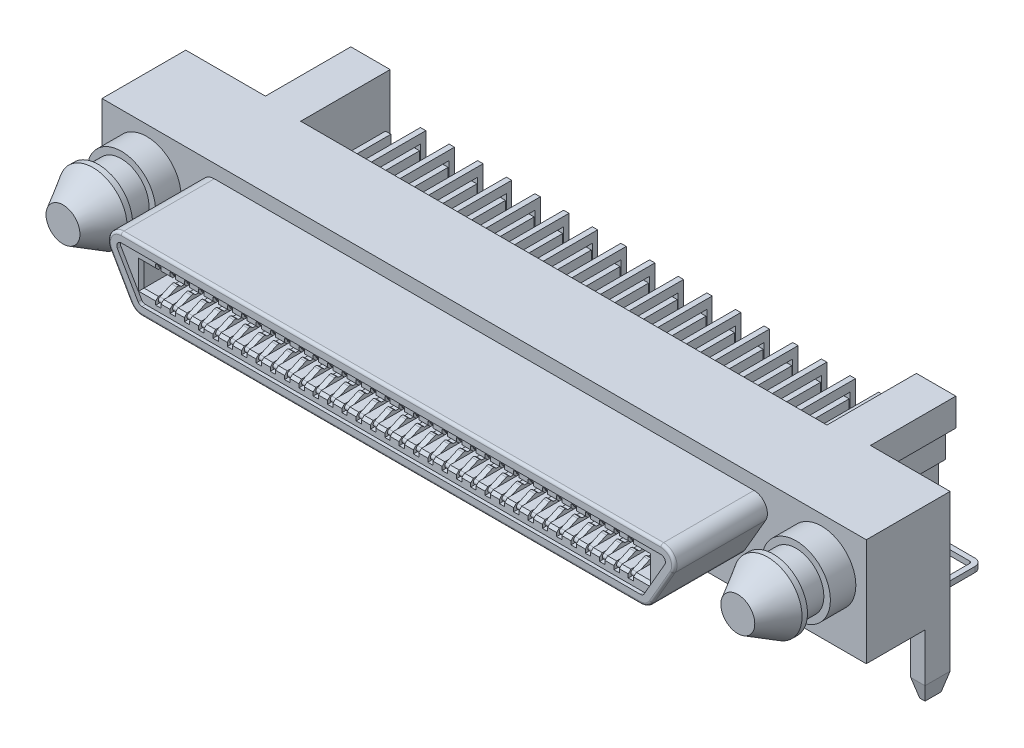
from build123d import *
from OCP.BRepFilletAPI import BRepFilletAPI_MakeChamfer

# Parameters (mm, degrees)
BODY_1_DEPTH                = 6
SKETCH68_W                  = 29.4
SKETCH68_H                  = 5
BODY_1_CUT_1_DEPTH          = 114.3
SKETCH76_W                  = 42.7
SKETCH76_H                  = 6
BODY_3_DEPTH                = 0.35
WT_SLOT_DEPTH               = 4.77
WT_1_DEPTH                  = 0.15
WT_2_DEPTH                  = 0.3
BODY_2_DEPTH                = 5.2
BODY_2_FIL_R                = 0.15
SKETCH62_W                  = 28.3
SKETCH62_H                  = 1.3
CORE_1_DEPTH                = 5
CORE_LEAD_IN_SIZE           = 0.15
SKETCH70_W                  = 0.8
SKETCH70_H                  = 1.4
GUIDE_POST_2_DEPTH          = 3.7
GUIDE_POST_2_POINT_SIZE     = 1
GUIDE_POST_2_POINT_SIZE2    = 0.25
SKETCH63_W                  = 5
SKETCH63_H                  = 0.5
SLOT_DEPTH                  = 0.15
SLOT_PAT_COUNT              = 34
SLOT_PAT_PITCH              = 0.8
CONTACT_1_DEPTH             = 0.15
CONTACT_2_DEPTH             = 0.15
CONTACT_1_PAT_COUNT         = 17
CONTACT_1_PAT_PITCH         = 1.6
CONTACT_2_PAT_COUNT         = 17
CONTACT_2_PAT_PITCH         = 1.6
SKETCH77_W                  = 0.3
SKETCH77_H                  = 0.3
CONTACT1_TAIL_DEPTH         = 3.99
SKETCH78_W                  = 0.3
SKETCH78_H                  = 0.3
CONTACT3_TAIL_DEPTH         = 3.99
CONTACT1_TAIL_PATTERN_COUNT = 17
CONTACT1_TAIL_PATTERN_PITCH = 1.6
CONTACT3_TAIL_PATTERN_COUNT = 17
CONTACT3_TAIL_PATTERN_PITCH = 1.6


with BuildPart() as part:
    # Sketch1 → Body 1 (new body)
    with BuildSketch(Plane(origin=(0, 0, 0), x_dir=(1, 0, 0), z_dir=(0, 1, 0))):
        Polygon((16.9, 9.1), (16.9, 4.33), (21.35, 4.33), (21.35, 0), (-21.35, 0), (-21.35, 4.33), (-16.9, 4.33), (-16.9, 9.1), align=None)
    extrude(amount=BODY_1_DEPTH)

    # Sketch68 → Body 1 Cut 1 (cut)
    with BuildSketch(Plane(origin=(0, 6, 0), x_dir=(1, 0, 0), z_dir=(0, 1, 0))):
        with Locations((0, 6.6)):
            Rectangle(SKETCH68_W, SKETCH68_H)
    extrude(amount=-BODY_1_CUT_1_DEPTH, mode=Mode.SUBTRACT)

    # Sketch76 → Body 3 (add)
    with BuildSketch(Plane.XY):
        with Locations((0, 3)):
            Rectangle(SKETCH76_W, SKETCH76_H)
    extrude(amount=BODY_3_DEPTH)

    # Sketch75 → Guide Post 1 (revolve)
    with BuildSketch(Plane(origin=(-18.85, 0, 0), x_dir=(0, 0, -1), z_dir=(1, 0, 0)), mode=Mode.PRIVATE) as guide_post_1_sk:
        Polygon((-0.35, 5.4125), (-1.772, 5.4125), (-1.772, 5.0475), (-3.052, 5.0475), (-3.052, 5.4125), (-3.356, 5.4125), (-5.03, 4.446015649), (-5.03, 3.4975), (-0.35, 3.4975), align=None)
    guide_post_1 = revolve(guide_post_1_sk.sketch.rotate(Axis((-18.85, 3.4975, -2.165), (0, 0, 1)), 90), axis=Axis((-18.85, 3.4975, -2.165), (0, 0, 1)))

    # Guide Post 1 Mir: Guide Post 1 across plane
    add(guide_post_1.mirror(Plane(origin=(0, 0, 0), x_dir=(0, 0, 1), z_dir=(1, 0, 0))))

    # Sketch65 → WT Slot (cut)
    with BuildSketch(Plane(origin=(0, 0, -9.1), x_dir=(-1, 0, 0), z_dir=(0, 0, -1))):
        Polygon((15.925, 4.450000052), (16.025, 4.450000052), (16.025, 4.847367304), (16.325, 4.847367304), (16.325, 4.450000052), (16.9, 4.450000052), (16.9, 0), (15.925, 0), align=None)
    wt_slot = extrude(amount=-WT_SLOT_DEPTH, mode=Mode.SUBTRACT)

    # Sketch66 → WT 1 (add, symmetric)
    with BuildSketch(Plane(origin=(-16.175, 0, 0), x_dir=(0, 0, -1), z_dir=(1, 0, 0))):
        with BuildLine():
            Line((9.1, 4.747367383), (4.33, 4.747367383))
            Line((4.33, 4.747367383), (4.33, 2.64736737))
            Line((4.33, 2.64736737), (5, 2.64736737))
            Line((5, 2.64736737), (5, 0.300000002))
            Line((5, 0.300000002), (5.291596718, 0.300000002))
            Line((5.291596718, 0.300000002), (5.291596718, 1.473683686))
            ThreePointArc((5.291596718, 1.473683686), (5.491596719, 1.673683687), (5.69159672, 1.473683686))
            Line((5.69159672, 1.473683686), (5.69159672, -1.58713511))
            ThreePointArc((5.69159672, -1.58713511), (5.686451936, -1.626083363), (5.671370502, -1.662359878))
            Line((5.671370502, -1.662359878), (5.589499751, -1.803598957))
            ThreePointArc((5.589499751, -1.803598957), (5.569468823, -1.871171992), (5.582510469, -1.94043431))
            Line((5.582510469, -1.94043431), (5.763236932, -2.341610585))
            ThreePointArc((5.763236932, -2.341610585), (5.931508253, -2.426653434), (6.049999999, -2.279999999))
            Line((6.049999999, -2.279999999), (6.049999999, 1.473683686))
            ThreePointArc((6.049999999, 1.473683686), (6.25, 1.673683687), (6.450000001, 1.473683686))
            Line((6.450000001, 1.473683686), (6.450000001, -2.279999999))
            ThreePointArc((6.450000001, -2.279999999), (6.568491747, -2.426653434), (6.736763068, -2.341610585))
            Line((6.736763068, -2.341610585), (6.917489531, -1.94043431))
            ThreePointArc((6.917489531, -1.94043431), (6.930531177, -1.871171992), (6.910500249, -1.803598957))
            Line((6.910500249, -1.803598957), (6.828629498, -1.662359878))
            ThreePointArc((6.828629498, -1.662359878), (6.813548064, -1.626083363), (6.80840328, -1.58713511))
            Line((6.80840328, -1.58713511), (6.80840328, 1.473683686))
            ThreePointArc((6.80840328, 1.473683686), (7.008403281, 1.673683687), (7.208403282, 1.473683686))
            Line((7.208403282, 1.473683686), (7.208403282, 0.300000002))
            Line((7.208403282, 0.300000002), (7.500000017, 0.300000002))
            Line((7.500000017, 0.300000002), (7.500000017, 2.64736737))
            Line((7.500000017, 2.64736737), (9.1, 2.64736737))
            Line((9.1, 2.64736737), (9.1, 4.747367383))
        make_face()
    wt_1 = extrude(amount=WT_1_DEPTH, both=True)

    # Sketch67 → WT 2 (add)
    with BuildSketch(Plane(origin=(0, 0, 0), x_dir=(1, 0, 0), z_dir=(0, 1, 0))):
        with BuildLine():
            Line((-19.5749, 7.500000017), (-16.025, 7.500000017))
            Line((-16.025, 7.500000017), (-16.025, 7.208403299))
            Line((-16.025, 7.208403299), (-19.5749, 7.208403299))
            ThreePointArc((-19.5749, 7.208403299), (-19.651552696, 7.176652713), (-19.683303282, 7.100000017))
            Line((-19.683303282, 7.100000017), (-19.683303282, 5.4))
            ThreePointArc((-19.683303282, 5.4), (-19.651552696, 5.323347304), (-19.5749, 5.291596718))
            Line((-19.5749, 5.291596718), (-16.025, 5.291596718))
            Line((-16.025, 5.291596718), (-16.025, 5))
            Line((-16.025, 5), (-19.5749, 5))
            ThreePointArc((-19.5749, 5), (-19.857742712, 5.117157288), (-19.9749, 5.4))
            Line((-19.9749, 5.4), (-19.9749, 7.100000017))
            ThreePointArc((-19.9749, 7.100000017), (-19.857742712, 7.382842729), (-19.5749, 7.500000017))
        make_face()
    wt_2 = extrude(amount=WT_2_DEPTH)

    # WT Slot Mir: WT Slot, WT 1, WT 2 across plane
    add(wt_slot.mirror(Plane(origin=(0, 0, 0), x_dir=(0, 0, 1), z_dir=(1, 0, 0))), mode=Mode.SUBTRACT)
    add(wt_1.mirror(Plane(origin=(0, 0, 0), x_dir=(0, 0, 1), z_dir=(1, 0, 0))))
    add(wt_2.mirror(Plane(origin=(0, 0, 0), x_dir=(0, 0, 1), z_dir=(1, 0, 0))))

    # Sketch61 → Body 2 (add)
    with BuildSketch(Plane.XY.offset(0.35)):
        with BuildLine():
            Line((-15.075, 5.25), (15.075, 5.25))
            ThreePointArc((15.075, 5.25), (15.724519053, 4.875), (15.724519053, 4.125))
            Line((15.724519053, 4.125), (14.569818514, 2.125))
            ThreePointArc((14.569818514, 2.125), (14.295299462, 1.850480947), (13.920299462, 1.75))
            Line((13.920299462, 1.75), (-13.920299462, 1.75))
            ThreePointArc((-13.920299462, 1.75), (-14.295299462, 1.850480947), (-14.569818514, 2.125))
            Line((-14.569818514, 2.125), (-15.724519053, 4.125))
            ThreePointArc((-15.724519053, 4.125), (-15.724519053, 4.875), (-15.075, 5.25))
        make_face()
        with BuildLine():
            Line((-15.075, 4.75), (15.075, 4.75))
            ThreePointArc((15.075, 4.75), (15.291506351, 4.625), (15.291506351, 4.375))
            Line((15.291506351, 4.375), (14.136805813, 2.375))
            ThreePointArc((14.136805813, 2.375), (14.045299462, 2.283493649), (13.920299462, 2.25))
            Line((13.920299462, 2.25), (-13.920299462, 2.25))
            ThreePointArc((-13.920299462, 2.25), (-14.045299462, 2.283493649), (-14.136805813, 2.375))
            Line((-14.136805813, 2.375), (-15.291506351, 4.375))
            ThreePointArc((-15.291506351, 4.375), (-15.291506351, 4.625), (-15.075, 4.75))
        make_face(mode=Mode.SUBTRACT)
    extrude(amount=BODY_2_DEPTH)

    # Body 2 Fil
    body_2_fil_edges = [part.edges().sort_by_distance(p)[0] for p in [
        (14.295299462, 1.850480947, 5.55),
        (15.147168784, 3.125, 5.55),
        (15.724519053, 4.875, 5.55),
        (0, 5.25, 5.55),
        (-15.724519053, 4.875, 5.55),
        (-15.147168784, 3.125, 5.55),
        (-14.295299462, 1.850480947, 5.55),
        (0, 1.75, 5.55),
    ]]
    fillet(body_2_fil_edges, radius=BODY_2_FIL_R)

    # Sketch62 → Core 1 (add)
    with BuildSketch(Plane.XY.offset(0.35)):
        with BuildLine():
            Line((15.075, 4.75), (-15.075, 4.75))
            ThreePointArc((-15.075, 4.75), (-15.291506351, 4.625), (-15.291506351, 4.375))
            Line((-15.291506351, 4.375), (-14.136805813, 2.375))
            ThreePointArc((-14.136805813, 2.375), (-14.045299462, 2.283493649), (-13.920299462, 2.25))
            Line((-13.920299462, 2.25), (13.920299462, 2.25))
            ThreePointArc((13.920299462, 2.25), (14.045299462, 2.283493649), (14.136805813, 2.375))
            Line((14.136805813, 2.375), (15.291506351, 4.375))
            ThreePointArc((15.291506351, 4.375), (15.291506351, 4.625), (15.075, 4.75))
        make_face()
        with Locations((0, 3.5)):
            Rectangle(SKETCH62_W, SKETCH62_H, mode=Mode.SUBTRACT)
    extrude(amount=CORE_1_DEPTH)

    # Core Lead-in
    core_lead_in_edges = [part.edges().sort_by_distance(p)[0] for p in [
        (-14.15, 3.5, 5.35),
        (0, 2.85, 5.35),
        (14.15, 3.5, 5.35),
        (0, 4.15, 5.35),
    ]]
    chamfer(core_lead_in_edges, length=CORE_LEAD_IN_SIZE)

    # Sketch70 → Guide Post 2 (add)
    with BuildSketch(Plane.XZ):
        with Locations((20.95, -3.63)):
            Rectangle(SKETCH70_W, SKETCH70_H)
        with Locations((-20.95, -3.63)):
            Rectangle(SKETCH70_W, SKETCH70_H)
    extrude(amount=GUIDE_POST_2_DEPTH)

    # Guide Post 2  Point: one chamfer whose edges measure the first distance from different faces: ONE call of the kernel's chamfer builder (chamfer() names one face for all edges)
    guide_post_2_point_edges_1 = [part.edges().sort_by_distance(p)[0] for p in [
        (20.95, -3.7, -4.33),
    ]]
    guide_post_2_point_side_1 = [part.faces().sort_by_distance(p)[0] for p in [
        (18.982387314, 2.461555528, -4.33),
    ]]
    guide_post_2_point_edges_2 = [part.edges().sort_by_distance(p)[0] for p in [
        (21.35, -3.7, -3.63),
    ]]
    guide_post_2_point_side_2 = [part.faces().sort_by_distance(p)[0] for p in [
        (21.35, 2.244648226, -2.245417919),
    ]]
    guide_post_2_point_edges_3 = [part.edges().sort_by_distance(p)[0] for p in [
        (20.95, -3.7, -2.93),
    ]]
    guide_post_2_point_side_3 = [part.faces().sort_by_distance(p)[0] for p in [
        (20.95, -1.85, -2.93),
    ]]
    guide_post_2_point_edges_4 = [part.edges().sort_by_distance(p)[0] for p in [
        (20.55, -3.7, -3.63),
    ]]
    guide_post_2_point_side_4 = [part.faces().sort_by_distance(p)[0] for p in [
        (20.55, -1.85, -3.63),
    ]]
    guide_post_2_point_edges_5 = [part.edges().sort_by_distance(p)[0] for p in [
        (-20.55, -3.7, -3.63),
    ]]
    guide_post_2_point_side_5 = [part.faces().sort_by_distance(p)[0] for p in [
        (-20.55, -1.85, -3.63),
    ]]
    guide_post_2_point_edges_6 = [part.edges().sort_by_distance(p)[0] for p in [
        (-20.95, -3.7, -4.33),
    ]]
    guide_post_2_point_side_6 = [part.faces().sort_by_distance(p)[0] for p in [
        (-18.982387314, 2.461555528, -4.33),
    ]]
    guide_post_2_point_edges_7 = [part.edges().sort_by_distance(p)[0] for p in [
        (-21.35, -3.7, -3.63),
    ]]
    guide_post_2_point_side_7 = [part.faces().sort_by_distance(p)[0] for p in [
        (-21.35, 2.244648226, -2.245417919),
    ]]
    guide_post_2_point_edges_8 = [part.edges().sort_by_distance(p)[0] for p in [
        (-20.95, -3.7, -2.93),
    ]]
    guide_post_2_point_side_8 = [part.faces().sort_by_distance(p)[0] for p in [
        (-20.95, -1.85, -2.93),
    ]]
    guide_post_2_point = BRepFilletAPI_MakeChamfer(part.part.solid().wrapped)
    for e in guide_post_2_point_edges_1:
        guide_post_2_point.Add(GUIDE_POST_2_POINT_SIZE, GUIDE_POST_2_POINT_SIZE2, e.wrapped, guide_post_2_point_side_1[0].wrapped)  # the first distance lies on this face
    for e in guide_post_2_point_edges_2:
        guide_post_2_point.Add(GUIDE_POST_2_POINT_SIZE, GUIDE_POST_2_POINT_SIZE2, e.wrapped, guide_post_2_point_side_2[0].wrapped)  # the first distance lies on this face
    for e in guide_post_2_point_edges_3:
        guide_post_2_point.Add(GUIDE_POST_2_POINT_SIZE, GUIDE_POST_2_POINT_SIZE2, e.wrapped, guide_post_2_point_side_3[0].wrapped)  # the first distance lies on this face
    for e in guide_post_2_point_edges_4:
        guide_post_2_point.Add(GUIDE_POST_2_POINT_SIZE, GUIDE_POST_2_POINT_SIZE2, e.wrapped, guide_post_2_point_side_4[0].wrapped)  # the first distance lies on this face
    for e in guide_post_2_point_edges_5:
        guide_post_2_point.Add(GUIDE_POST_2_POINT_SIZE, GUIDE_POST_2_POINT_SIZE2, e.wrapped, guide_post_2_point_side_5[0].wrapped)  # the first distance lies on this face
    for e in guide_post_2_point_edges_6:
        guide_post_2_point.Add(GUIDE_POST_2_POINT_SIZE, GUIDE_POST_2_POINT_SIZE2, e.wrapped, guide_post_2_point_side_6[0].wrapped)  # the first distance lies on this face
    for e in guide_post_2_point_edges_7:
        guide_post_2_point.Add(GUIDE_POST_2_POINT_SIZE, GUIDE_POST_2_POINT_SIZE2, e.wrapped, guide_post_2_point_side_7[0].wrapped)  # the first distance lies on this face
    for e in guide_post_2_point_edges_8:
        guide_post_2_point.Add(GUIDE_POST_2_POINT_SIZE, GUIDE_POST_2_POINT_SIZE2, e.wrapped, guide_post_2_point_side_8[0].wrapped)  # the first distance lies on this face
    add(Compound.cast(guide_post_2_point.Shape()), mode=Mode.REPLACE)

    # Sketch63 → Slot (cut, symmetric)
    with BuildSketch(Plane(origin=(13.2, 0, 0), x_dir=(0, 0, -1), z_dir=(1, 0, 0))):
        with Locations((-2.85, 4.25)):
            Rectangle(SKETCH63_W, SKETCH63_H)
        with Locations((-2.85, 2.75)):
            Rectangle(SKETCH63_W, SKETCH63_H)
    slot = extrude(amount=SLOT_DEPTH, both=True, mode=Mode.SUBTRACT)

    # Slot Pat: Slot ×34
    with Locations(*[(-i * SLOT_PAT_PITCH, 0, 0) for i in range(1, SLOT_PAT_COUNT)]):
        add(slot, mode=Mode.SUBTRACT)

    # Sketch69 → Contact 1 (add, symmetric)
    with BuildSketch(Plane(origin=(13.2, 0, 0), x_dir=(0, 0, -1), z_dir=(1, 0, 0))):
        with BuildLine():
            Line((-5.05, 4.5), (8.64, 4.5))
            Line((8.64, 4.5), (8.64, 1.7))
            Line((8.64, 1.7), (8.34, 1.7))
            Line((8.34, 1.7), (8.34, 4))
            Line((8.34, 4), (-4.230918697, 4))
            Line((-4.230918697, 4), (-4.304525443, 3.938015372))
            ThreePointArc((-4.304525443, 3.938015372), (-4.380933964, 3.904120018), (-4.463619076, 3.916380902))
            Line((-4.463619076, 3.916380902), (-5.112473272, 4.213628851))
            ThreePointArc((-5.112473272, 4.213628851), (-5.196553186, 4.381971297), (-5.05, 4.5))
        make_face()
        with BuildLine():
            Line((-5.05, 2.5), (5.99, 2.5))
            Line((5.99, 2.5), (5.99, 1.7))
            Line((5.99, 1.7), (6.29, 1.7))
            Line((6.29, 1.7), (6.29, 3))
            Line((6.29, 3), (-4.230918697, 3))
            Line((-4.230918697, 3), (-4.304525443, 3.061984628))
            ThreePointArc((-4.304525443, 3.061984628), (-4.380933964, 3.095879982), (-4.463619076, 3.083619098))
            Line((-4.463619076, 3.083619098), (-5.112473272, 2.786371149))
            ThreePointArc((-5.112473272, 2.786371149), (-5.196553186, 2.618028703), (-5.05, 2.5))
        make_face()
    contact_1 = extrude(amount=CONTACT_1_DEPTH, both=True)

    # Sketch73 → Contact 2 (add, symmetric)
    with BuildSketch(Plane(origin=(12.4, 0, 0), x_dir=(0, 0, -1), z_dir=(1, 0, 0))):
        with BuildLine():
            Line((4.84, 1.7), (4.84, 2.5))
            Line((4.84, 2.5), (-5.05, 2.5))
            ThreePointArc((-5.05, 2.5), (-5.196553186, 2.618028703), (-5.112473272, 2.786371149))
            Line((-5.112473272, 2.786371149), (-4.463619076, 3.083619098))
            ThreePointArc((-4.463619076, 3.083619098), (-4.380933964, 3.095879982), (-4.304525443, 3.061984628))
            Line((-4.304525443, 3.061984628), (-4.230918697, 3))
            Line((-4.230918697, 3), (5.14, 3))
            Line((5.14, 3), (5.14, 1.7))
            Line((5.14, 1.7), (4.84, 1.7))
        make_face()
        with BuildLine():
            Line((7.49, 1.7), (7.49, 4.5))
            Line((7.49, 4.5), (-5.05, 4.5))
            ThreePointArc((-5.05, 4.5), (-5.196553186, 4.381971297), (-5.112473272, 4.213628851))
            Line((-5.112473272, 4.213628851), (-4.463619076, 3.916380902))
            ThreePointArc((-4.463619076, 3.916380902), (-4.380933964, 3.904120018), (-4.304525443, 3.938015372))
            Line((-4.304525443, 3.938015372), (-4.230918697, 4))
            Line((-4.230918697, 4), (7.19, 4))
            Line((7.19, 4), (7.19, 1.7))
            Line((7.19, 1.7), (7.49, 1.7))
        make_face()
    contact_2 = extrude(amount=CONTACT_2_DEPTH, both=True)

    # Contact 1 Pat: Contact 1 ×17
    with Locations(*[(-i * CONTACT_1_PAT_PITCH, 0, 0) for i in range(1, CONTACT_1_PAT_COUNT)]):
        add(contact_1)

    # Contact 2 Pat: Contact 2 ×17
    with Locations(*[(-i * CONTACT_2_PAT_PITCH, 0, 0) for i in range(1, CONTACT_2_PAT_COUNT)]):
        add(contact_2)

    # Sketch77 → Contact1 Tail (add)
    with BuildSketch(Plane.XZ.offset(-1.7)):
        with Locations((13, -8.49)):
            Rectangle(SKETCH77_W, SKETCH77_H)
        with Locations((13.4, -6.14)):
            Rectangle(SKETCH77_W, SKETCH77_H)
    contact1_tail = extrude(amount=CONTACT1_TAIL_DEPTH)

    # Sketch78 → Contact3 Tail (add)
    with BuildSketch(Plane.XZ.offset(-1.7)):
        with Locations((12.6, -4.99)):
            Rectangle(SKETCH78_W, SKETCH78_H)
        with Locations((12.2, -7.34)):
            Rectangle(SKETCH78_W, SKETCH78_H)
    contact3_tail = extrude(amount=CONTACT3_TAIL_DEPTH)

    # Contact1 Tail Pattern: Contact1 Tail ×17
    with Locations(*[(-i * CONTACT1_TAIL_PATTERN_PITCH, 0, 0) for i in range(1, CONTACT1_TAIL_PATTERN_COUNT)]):
        add(contact1_tail)

    # Contact3 Tail Pattern: Contact3 Tail ×17
    with Locations(*[(-i * CONTACT3_TAIL_PATTERN_PITCH, 0, 0) for i in range(1, CONTACT3_TAIL_PATTERN_COUNT)]):
        add(contact3_tail)


solid = part.part
